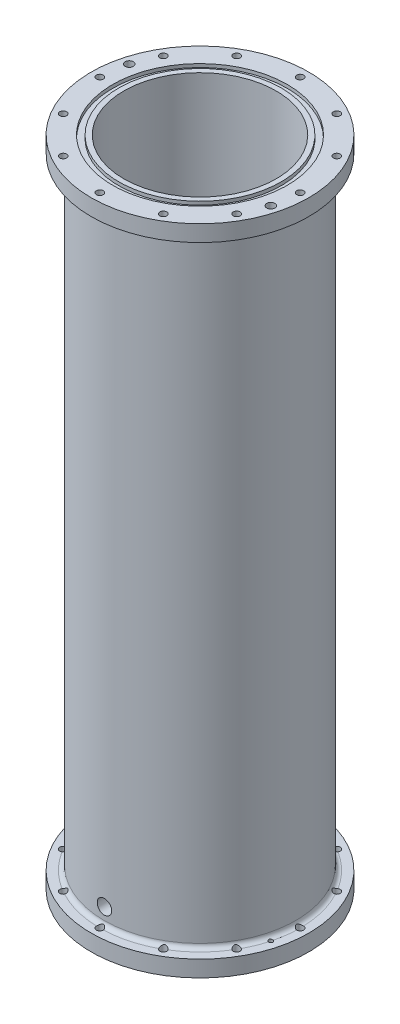
from build123d import *

# Parameters (mm, degrees)
SKETCH2_R               = 55.88
SKETCH2_R_2             = 44.45
BASE_CYLINDER_DEPTH     = 381
SKETCH3_R               = 63.5
SKETCH3_R_2             = 44.45
AFT_FLANGE_DEPTH        = 9.525
SKETCH6_R               = 50.9524
SKETCH6_R_2             = 47.4218
AFT_O_RING_DEPTH        = 1.9812
BOLT_CIRCLE_D           = 4.0386
HOLE1_D                 = 2.38125
HOLE1_CBORE_D           = 4.7625
HOLE1_CBORE_DEPTH       = 4.7625
F_3_8_24_TAPPED_HOLE1_D = 8.4328
FILLET1_R               = 2.54


# Read off the part's stored shape, not the designer's step: 1/8 NPT Tapped ThermocoupleHole
with BuildPart() as part:
    # Sketch2 → Base Cylinder (new body)
    with BuildSketch(Plane(origin=(0, 0, 0), x_dir=(1, 0, 0), z_dir=(0, 1, 0))):
        with Locations(Location((0, 0, 0), (0, 0, 270))):
            Circle(SKETCH2_R)
        with Locations(Location((0, 0, 0), (0, 0, 270))):
            Circle(SKETCH2_R_2, mode=Mode.SUBTRACT)
    extrude(amount=BASE_CYLINDER_DEPTH)

    # Sketch3 → Aft Flange (add)
    with BuildSketch(Plane.XZ):
        with Locations(Location((0, 0, 0), (0, 0, 270))):
            Circle(SKETCH3_R)
        with Locations(Location((0, 0, 0), (0, 0, 90))):
            Circle(SKETCH3_R_2, mode=Mode.SUBTRACT)
    aft_flange = extrude(amount=-AFT_FLANGE_DEPTH)

    # Sketch6 → Aft O-Ring (cut)
    with BuildSketch(Plane.XZ):
        with Locations(Location((0, 0, 0), (0, 0, 270))):
            Circle(SKETCH6_R)
        with Locations(Location((0, 0, 0), (0, 0, 270))):
            Circle(SKETCH6_R_2, mode=Mode.SUBTRACT)
    aft_o_ring = extrude(amount=-AFT_O_RING_DEPTH, mode=Mode.SUBTRACT)

    # Bolt Circle (through all)
    with Locations(Plane(origin=(0, 0, 0), x_dir=(-1, 0, 0), z_dir=(0, -1, 0))):
        with Locations((-29.21, -50.593204089), (-50.593204089, -29.21), (-58.42, 0), (-50.593204089, 29.21), (-29.21, 50.593204089), (0, 58.42), (29.21, 50.593204089), (50.593204089, 29.21), (58.42, 0), (50.593204089, -29.21), (29.21, -50.593204089), (0, -58.42)):
            bolt_circle = Hole(BOLT_CIRCLE_D / 2)

    # Hole1 (through all)
    with Locations(Plane(origin=(0, 0, 0), x_dir=(-1, 0, 0), z_dir=(0, -1, 0))):
        with Locations((56.429386772, 15.120208615), (-56.429386772, -15.120208615)):
            hole1 = CounterBoreHole(HOLE1_D / 2, HOLE1_CBORE_D / 2, HOLE1_CBORE_DEPTH)

    # 1/8 NPT Tapped ThermocoupleHole outline → 1/8 NPT Tapped ThermocoupleHole (revolve, cut)
    with BuildSketch(Plane.XZ.offset(-19.05)):
        Polygon((4.742738789, -55.879999633), (4.537401096, -49.022), (4.2164, -49.022), (4.2164, -44.24954189), (0, -44.24954189), (0, -55.879999633), align=None)
    revolve(axis=Axis((0, 19.05, 0), (0, 0, 1)), mode=Mode.SUBTRACT)

    # 3/8-24 Tapped Hole1 (through all)
    with Locations(Plane.XY.offset(55.88)):
        with Locations((0, 19.05)):
            Hole(F_3_8_24_TAPPED_HOLE1_D / 2)

    # Mirror1: Aft Flange, Aft O-Ring, Bolt Circle, Hole1 across plane
    add(aft_flange.mirror(Plane.ZX.offset(190.5)))
    add(aft_o_ring.mirror(Plane.ZX.offset(190.5)), mode=Mode.SUBTRACT)
    add(bolt_circle.mirror(Plane.ZX.offset(190.5)), mode=Mode.SUBTRACT)
    add(hole1.mirror(Plane.ZX.offset(190.5)), mode=Mode.SUBTRACT)

    # Fillet1
    # the kernel refuses this fillet: 2.54 mm, written as the material it adds along each edge
    with BuildSketch(Plane(origin=(0, 9.525, 0), x_dir=(0, 0, 1), z_dir=(1, 0, 0))) as fillet1_piece_1_section:
        with BuildLine():
            CenterArc((55.88 + FILLET1_R, -FILLET1_R), FILLET1_R, 90, 90)
            Line((55.88, -FILLET1_R), (55.88, 0))
            Line((55.88, 0), (55.88 + FILLET1_R, 0))
        make_face()
    fillet1_piece_1 = revolve(axis=Axis((0, 9.525, 0), (0, -1, 0)), mode=Mode.PRIVATE)
    fillet1_piece_1 = fillet1_piece_1 - Plane(origin=(-29.21, 11.387420878, 50.593204089), x_dir=(1, 0, 0), z_dir=(0, 1, 0)) * Cylinder(2.0193, 234, mode=Mode.PRIVATE)
    fillet1_piece_1 = fillet1_piece_1 - Plane(origin=(-50.593204089, 11.387420878, 29.21), x_dir=(1, 0, 0), z_dir=(0, 1, 0)) * Cylinder(2.0193, 234, mode=Mode.PRIVATE)
    fillet1_piece_1 = fillet1_piece_1 - Plane(origin=(0, 11.387420878, 58.42), x_dir=(1, 0, 0), z_dir=(0, 1, 0)) * Cylinder(2.0193, 234, mode=Mode.PRIVATE)
    fillet1_piece_1 = fillet1_piece_1 - Plane(origin=(29.21, 11.387420878, 50.593204089), x_dir=(1, 0, 0), z_dir=(0, 1, 0)) * Cylinder(2.0193, 234, mode=Mode.PRIVATE)
    fillet1_piece_1 = fillet1_piece_1 - Plane(origin=(50.593204089, 11.387420878, 29.21), x_dir=(1, 0, 0), z_dir=(0, 1, 0)) * Cylinder(2.0193, 234, mode=Mode.PRIVATE)
    fillet1_piece_1 = fillet1_piece_1 - Plane(origin=(-58.42, 11.387420878, 0), x_dir=(1, 0, 0), z_dir=(0, 1, 0)) * Cylinder(2.0193, 234, mode=Mode.PRIVATE)
    fillet1_piece_1 = fillet1_piece_1 - Plane(origin=(-50.593204089, 11.387420878, -29.21), x_dir=(1, 0, 0), z_dir=(0, 1, 0)) * Cylinder(2.0193, 234, mode=Mode.PRIVATE)
    fillet1_piece_1 = fillet1_piece_1 - Plane(origin=(-29.21, 11.387420878, -50.593204089), x_dir=(1, 0, 0), z_dir=(0, 1, 0)) * Cylinder(2.0193, 234, mode=Mode.PRIVATE)
    fillet1_piece_1 = fillet1_piece_1 - Plane(origin=(58.42, 11.387420878, 0), x_dir=(1, 0, 0), z_dir=(0, 1, 0)) * Cylinder(2.0193, 234, mode=Mode.PRIVATE)
    fillet1_piece_1 = fillet1_piece_1 - Plane(origin=(50.593204089, 11.387420878, -29.21), x_dir=(1, 0, 0), z_dir=(0, 1, 0)) * Cylinder(2.0193, 234, mode=Mode.PRIVATE)
    fillet1_piece_1 = fillet1_piece_1 - Plane(origin=(0, 11.387420878, -58.42), x_dir=(1, 0, 0), z_dir=(0, 1, 0)) * Cylinder(2.0193, 234, mode=Mode.PRIVATE)
    fillet1_piece_1 = fillet1_piece_1 - Plane(origin=(29.21, 11.387420878, -50.593204089), x_dir=(1, 0, 0), z_dir=(0, 1, 0)) * Cylinder(2.0193, 234, mode=Mode.PRIVATE)
    fillet1_piece_1 = fillet1_piece_1 - Plane(origin=(-56.429386772, 11.387420878, -15.120208615), x_dir=(1, 0, 0), z_dir=(0, 1, 0)) * Cylinder(1.190625, 234, mode=Mode.PRIVATE)
    fillet1_piece_1 = fillet1_piece_1 - Plane(origin=(56.429386772, 11.387420878, 15.120208615), x_dir=(1, 0, 0), z_dir=(0, 1, 0)) * Cylinder(1.190625, 234, mode=Mode.PRIVATE)
    add(fillet1_piece_1)
    with BuildSketch(Plane(origin=(0, 371.475, 0), x_dir=(0, 0, 1), z_dir=(1, 0, 0))) as fillet1_piece_2_section:
        with BuildLine():
            CenterArc((55.88 + FILLET1_R, FILLET1_R), FILLET1_R, 180, 90)
            Line((55.88 + FILLET1_R, 0), (55.88, 0))
            Line((55.88, 0), (55.88, FILLET1_R))
        make_face()
    fillet1_piece_2 = revolve(axis=Axis((0, 371.475, 0), (0, -1, 0)), mode=Mode.PRIVATE)
    fillet1_piece_2 = fillet1_piece_2 - Plane(origin=(-29.21, 369.612580341, -50.593204089), x_dir=(1, 0, 0), z_dir=(0, -1, 0)) * Cylinder(2.0193, 234, mode=Mode.PRIVATE)
    fillet1_piece_2 = fillet1_piece_2 - Plane(origin=(-50.593204089, 369.612580341, -29.21), x_dir=(1, 0, 0), z_dir=(0, -1, 0)) * Cylinder(2.0193, 234, mode=Mode.PRIVATE)
    fillet1_piece_2 = fillet1_piece_2 - Plane(origin=(-56.429386772, 369.612580341, -15.120208615), x_dir=(1, 0, 0), z_dir=(0, -1, 0)) * Cylinder(1.190625, 234, mode=Mode.PRIVATE)
    fillet1_piece_2 = fillet1_piece_2 - Plane(origin=(0, 369.612580341, -58.42), x_dir=(1, 0, 0), z_dir=(0, -1, 0)) * Cylinder(2.0193, 234, mode=Mode.PRIVATE)
    fillet1_piece_2 = fillet1_piece_2 - Plane(origin=(29.21, 369.612580341, -50.593204089), x_dir=(1, 0, 0), z_dir=(0, -1, 0)) * Cylinder(2.0193, 234, mode=Mode.PRIVATE)
    fillet1_piece_2 = fillet1_piece_2 - Plane(origin=(50.593204089, 369.612580341, -29.21), x_dir=(1, 0, 0), z_dir=(0, -1, 0)) * Cylinder(2.0193, 234, mode=Mode.PRIVATE)
    fillet1_piece_2 = fillet1_piece_2 - Plane(origin=(-58.42, 369.612580341, 0), x_dir=(1, 0, 0), z_dir=(0, -1, 0)) * Cylinder(2.0193, 234, mode=Mode.PRIVATE)
    fillet1_piece_2 = fillet1_piece_2 - Plane(origin=(-50.593204089, 369.612580341, 29.21), x_dir=(1, 0, 0), z_dir=(0, -1, 0)) * Cylinder(2.0193, 234, mode=Mode.PRIVATE)
    fillet1_piece_2 = fillet1_piece_2 - Plane(origin=(-29.21, 369.612580341, 50.593204089), x_dir=(1, 0, 0), z_dir=(0, -1, 0)) * Cylinder(2.0193, 234, mode=Mode.PRIVATE)
    fillet1_piece_2 = fillet1_piece_2 - Plane(origin=(58.42, 369.612580341, 0), x_dir=(1, 0, 0), z_dir=(0, -1, 0)) * Cylinder(2.0193, 234, mode=Mode.PRIVATE)
    fillet1_piece_2 = fillet1_piece_2 - Plane(origin=(56.429386772, 369.612580341, 15.120208615), x_dir=(1, 0, 0), z_dir=(0, -1, 0)) * Cylinder(1.190625, 234, mode=Mode.PRIVATE)
    fillet1_piece_2 = fillet1_piece_2 - Plane(origin=(50.593204089, 369.612580341, 29.21), x_dir=(1, 0, 0), z_dir=(0, -1, 0)) * Cylinder(2.0193, 234, mode=Mode.PRIVATE)
    fillet1_piece_2 = fillet1_piece_2 - Plane(origin=(0, 369.612580341, 58.42), x_dir=(1, 0, 0), z_dir=(0, -1, 0)) * Cylinder(2.0193, 234, mode=Mode.PRIVATE)
    fillet1_piece_2 = fillet1_piece_2 - Plane(origin=(29.21, 369.612580341, 50.593204089), x_dir=(1, 0, 0), z_dir=(0, -1, 0)) * Cylinder(2.0193, 234, mode=Mode.PRIVATE)
    add(fillet1_piece_2)


solid = part.part
